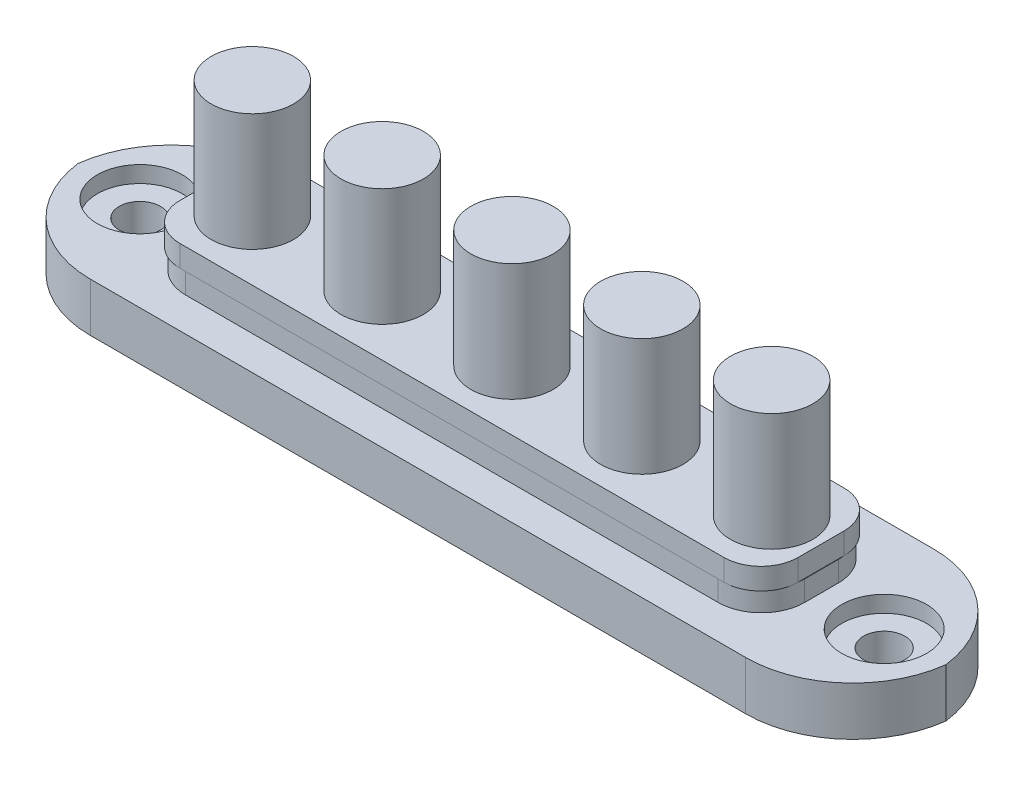
from build123d import *

# Parameters (mm, degrees)
SKETCH1_W           = 105.5
SKETCH1_H           = 22.8
BOSS_EXTRUDE1_DEPTH = 2.96
FILLET1_R           = 13
SKETCH2_R           = 2.5
CUT_EXTRUDE1_DEPTH  = 5.92
SKETCH3_R           = 5.15
CUT_EXTRUDE2_DEPTH  = 2
SKETCH4_W           = 75.1
SKETCH4_H           = 14.58
BOSS_EXTRUDE3_DEPTH = 2.48
FILLET2_R           = 5.25
SKETCH6_W           = 75
SKETCH6_H           = 14.59
BOSS_EXTRUDE4_DEPTH = 2.6
FILLET4_R           = 4.5
SKETCH7_R           = 5
BOSS_EXTRUDE5_DEPTH = 14.25


with BuildPart() as part:
    # Sketch1 → Boss-Extrude1 (new, symmetric)
    with BuildSketch(Plane(origin=(0, 0, 0), x_dir=(1, 0, 0), z_dir=(0, 1, 0))):
        Rectangle(SKETCH1_W, SKETCH1_H)
    extrude(amount=BOSS_EXTRUDE1_DEPTH, both=True)

    # Fillet1
    # the kernel refuses this fillet: 13 mm, written as the material it takes off along each edge
    with BuildSketch(Plane(origin=(-52.75, 35.46, -11.4), x_dir=(1, 0, 0), z_dir=(0, -1, 0)), Plane(origin=(52.75, -35.46, -11.4), x_dir=(-1, 0, 0), z_dir=(0, 1, 0))) as fillet1_piece_1:
        with BuildLine():
            CenterArc((FILLET1_R, FILLET1_R), FILLET1_R, 180, 90)
            Line((0, FILLET1_R), (0, 0))
            Line((0, 0), (FILLET1_R, 0))
        make_face()
    extrude(amount=70.92, mode=Mode.SUBTRACT)
    with BuildSketch(Plane(origin=(-52.75, 35.46, 11.4), x_dir=(1, 0, 0), z_dir=(0, -1, 0)), Plane(origin=(52.75, -35.46, 11.4), x_dir=(-1, 0, 0), z_dir=(0, 1, 0))) as fillet1_piece_2:
        with BuildLine():
            CenterArc((FILLET1_R, -FILLET1_R), FILLET1_R, 90, 90)
            Line((0, -FILLET1_R), (0, 0))
            Line((0, 0), (FILLET1_R, 0))
        make_face()
    extrude(amount=70.92, mode=Mode.SUBTRACT)

    # Sketch2 → Cut-Extrude1 (cut)
    with BuildSketch(Plane(origin=(0, 2.96, 0), x_dir=(1, 0, 0), z_dir=(0, 1, 0))):
        with Locations(Location((-45.151162738, 0, 0), (0, 0, 270))):
            Circle(SKETCH2_R)
        with Locations(Location((45.151162738, 0, 0), (0, 0, 270))):
            Circle(SKETCH2_R)
    extrude(amount=-CUT_EXTRUDE1_DEPTH, mode=Mode.SUBTRACT)

    # Sketch3 → Cut-Extrude2 (cut)
    with BuildSketch(Plane(origin=(0, 2.96, 0), x_dir=(1, 0, 0), z_dir=(0, 1, 0))):
        with Locations(Location((-45.151162738, 0, 0), (0, 0, 270))):
            Circle(SKETCH3_R)
        with Locations(Location((45.151162738, 0, 0), (0, 0, 270))):
            Circle(SKETCH3_R)
    extrude(amount=-CUT_EXTRUDE2_DEPTH, mode=Mode.SUBTRACT)

    # Sketch4 → Boss-Extrude3 (add)
    with BuildSketch(Plane(origin=(0, 2.96, 0), x_dir=(1, 0, 0), z_dir=(0, 1, 0))):
        Rectangle(SKETCH4_W, SKETCH4_H)
    extrude(amount=BOSS_EXTRUDE3_DEPTH)

    # Fillet2
    fillet2_edges = [part.edges().sort_by_distance(p)[0] for p in [
        (-37.55, 4.2, -7.29),
        (-37.55, 4.2, 7.29),
        (37.55, 4.2, 7.29),
        (37.55, 4.2, -7.29),
    ]]
    fillet(fillet2_edges, radius=FILLET2_R)

    # Sketch6 → Boss-Extrude4 (add)
    with BuildSketch(Plane(origin=(0, 5.44, 0), x_dir=(1, 0, 0), z_dir=(0, 1, 0))):
        Rectangle(SKETCH6_W, SKETCH6_H)
    extrude(amount=BOSS_EXTRUDE4_DEPTH)

    # Fillet4
    fillet4_edges = [part.edges().sort_by_distance(p)[0] for p in [
        (-37.5, 6.74, -7.295),
        (-37.5, 6.74, 7.295),
        (37.5, 6.74, 7.295),
        (37.5, 6.74, -7.295),
    ]]
    fillet(fillet4_edges, radius=FILLET4_R)

    # Sketch7 → Boss-Extrude5 (add)
    with BuildSketch(Plane(origin=(0, 8.04, 0), x_dir=(1, 0, 0), z_dir=(0, 1, 0))):
        with Locations(Location((-31.5, 0, 0), (0, 0, 90))):
            Circle(SKETCH7_R)
        with Locations(Location((-15.75, 0, 0), (0, 0, 90))):
            Circle(SKETCH7_R)
        with Locations(Location((0, 0, 0), (0, 0, 90))):
            Circle(SKETCH7_R)
        with Locations(Location((15.75, 0, 0), (0, 0, 90))):
            Circle(SKETCH7_R)
        with Locations(Location((31.5, 0, 0), (0, 0, 90))):
            Circle(SKETCH7_R)
    extrude(amount=BOSS_EXTRUDE5_DEPTH)


solid = part.part
